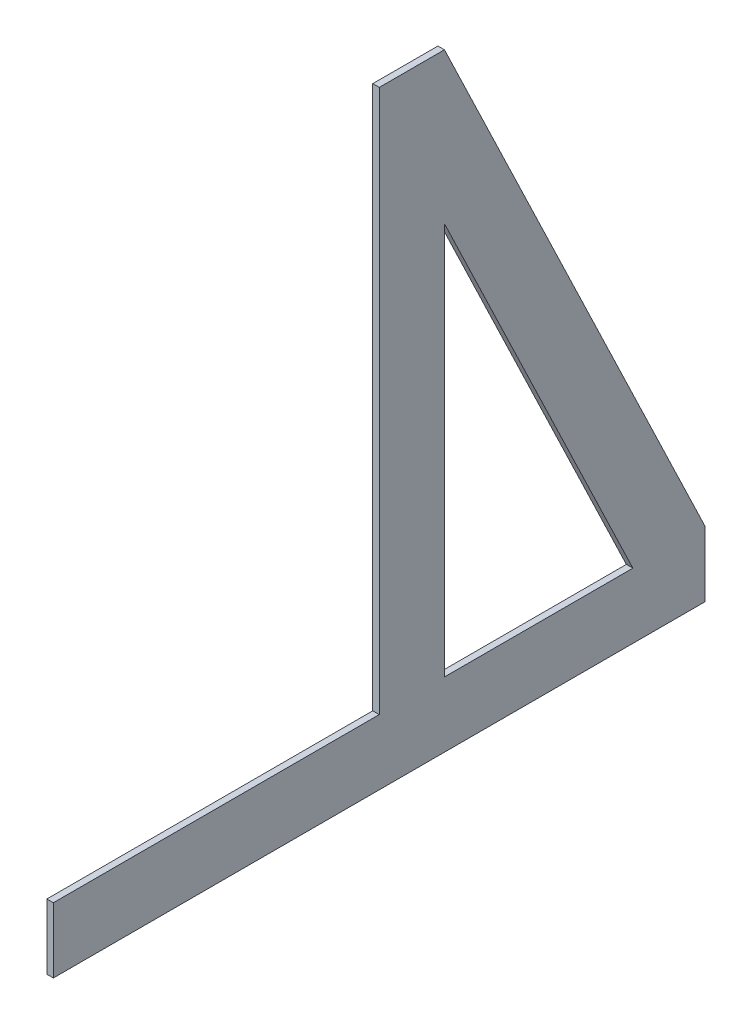
from build123d import *

# Parameters (mm, degrees)
EXTRUDE_531_DEPTH = 6


with BuildPart() as part:
    # Sketch 523 → Extrude 531 (new body)
    with BuildSketch(Plane(origin=(0, 0, 0), x_dir=(0, 0, -1), z_dir=(1, 0, 0))):
        Polygon((-593.846153846, -224.461538462), (6.153846154, -224.461538462), (6.153846154, -164.461538462), (-233.846153846, 335.538461538), (-293.846153846, 335.538461538), (-293.846153846, -164.461538462), (-593.846153846, -164.461538462), align=None)
        Polygon((-233.846153846, -164.461538462), (-60.400192041, -164.461538462), (-233.846153846, 196.8842153), align=None, mode=Mode.SUBTRACT)
    extrude(amount=EXTRUDE_531_DEPTH)


solid = part.part
